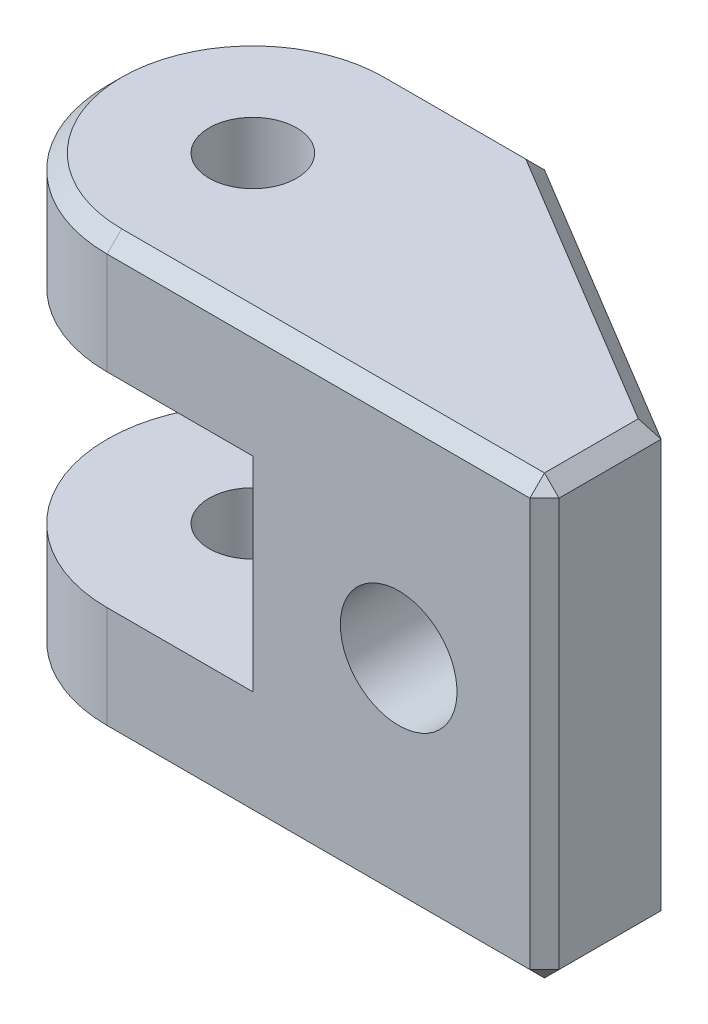
from build123d import *

# Parameters (mm, degrees)
EXTRUDE_1_DEPTH     = 15
SKETCH_2_W          = 10
SKETCH_2_H          = 7
CUT_EXTRUDE_1_DEPTH = 27.925824036
SKETCH_3_W          = 6
SKETCH_3_H          = 7
CUT_EXTRUDE_2_DEPTH = 21.615528128
SKETCH_4_R          = 2
CUT_EXTRUDE_3_DEPTH = 26.709920264
FILLET_1_R          = 5
SKETCH_5_R          = 1.5
CUT_EXTRUDE_4_DEPTH = 27.925824036
CHAMFER_1_SIZE      = 0.5


with BuildPart() as part:
    # ｽｹｯﾁ1 → ﾎﾞｽ - 押し出し1 (new body)
    with BuildSketch(Plane(origin=(0, 0, 0), x_dir=(1, 0, 0), z_dir=(0, 1, 0))):
        Polygon((0, 0), (20, 0), (20, 4), (10, 10), (0, 10), align=None)
    extrude(amount=EXTRUDE_1_DEPTH)

    # ｽｹｯﾁ2 → ｶｯﾄ - 押し出し1 (cut, through all)
    with BuildSketch(Plane(origin=(0, 0, -10), x_dir=(-1, 0, 0), z_dir=(0, 0, -1))):
        with Locations((-5, 7.5)):
            Rectangle(SKETCH_2_W, SKETCH_2_H)
    extrude(amount=-CUT_EXTRUDE_1_DEPTH, mode=Mode.SUBTRACT)

    # ｽｹｯﾁ3 → ｶｯﾄ - 押し出し2 (cut, through all)
    with BuildSketch(Plane.ZY.offset(-10)):
        with Locations((-7, 7.5)):
            Rectangle(SKETCH_3_W, SKETCH_3_H)
    extrude(amount=-CUT_EXTRUDE_2_DEPTH, mode=Mode.SUBTRACT)

    # ｽｹｯﾁ4 → ｶｯﾄ - 押し出し3 (cut, through all)
    with BuildSketch(Plane(origin=(0, 0, -4), x_dir=(-1, 0, 0), z_dir=(0, 0, -1))):
        with Locations((-15, 7.5)):
            Circle(SKETCH_4_R)
    extrude(amount=-CUT_EXTRUDE_3_DEPTH, mode=Mode.SUBTRACT)

    # ﾌｨﾚｯﾄ1
    fillet_1_edges = [part.edges().sort_by_distance(p)[0] for p in [
        (0, 2, 0),
        (0, 2, -10),
        (0, 13, 0),
        (0, 13, -10),
    ]]
    fillet(fillet_1_edges, radius=FILLET_1_R - 0.0001)  # a hair under: the kernel refuses the full size

    # ｽｹｯﾁ5 → ｶｯﾄ - 押し出し4 (cut, through all)
    with BuildSketch(Plane.XZ):
        with Locations(Location((5, -5, 0), (0, 0, 270))):
            Circle(SKETCH_5_R)
    extrude(amount=-CUT_EXTRUDE_4_DEPTH, mode=Mode.SUBTRACT)

    # 面取り1
    chamfer_1_edges = [part.edges().sort_by_distance(p)[0] for p in [
        (20, 15, -2),
        (15, 15, -7),
        (7.49995, 15, -10),
        (7.49995, 0, -10),
        (12.49995, 0, 0),
        (12.49995, 15, 0),
        (15, 0, -7),
        (1.464436805, 0, -8.535563195),
        (1.464436805, 0, -1.464436805),
        (20, 0, -2),
        (1.464436805, 15, -8.535563195),
        (1.464436805, 15, -1.464436805),
        (20, 7.5, 0),
    ]]
    chamfer(chamfer_1_edges, length=CHAMFER_1_SIZE)


solid = part.part
